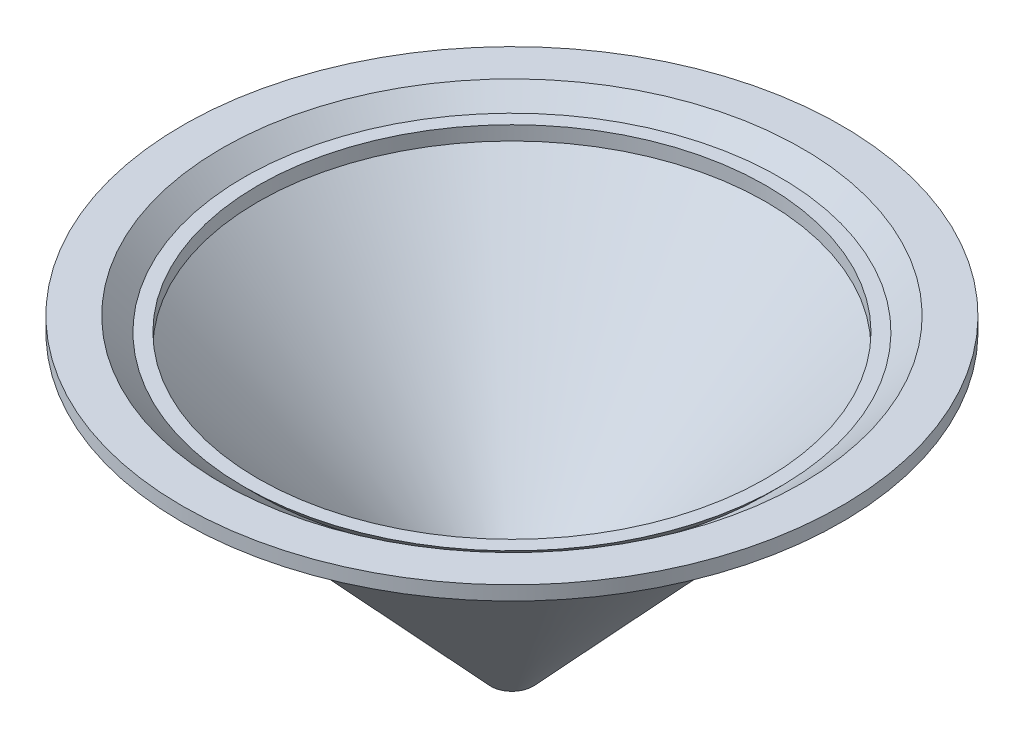
from build123d import *

# Parameters (mm, degrees)
SKETCH1_R           = 46.7275
BOSS_EXTRUDE2_DEPTH = 2


# Read off the part's stored shape, not the designer's step: Shell1
with BuildPart() as part:
    # Sketch2 → Revolve1 (revolve)
    with BuildSketch(Plane.XY):
        Polygon((0, 0), (0, -42), (-3, -42), (-42, 0), align=None)
    revolve(axis=Axis((0, 0, 0), (0, -1, 0)))

    # Sketch1 → Boss-Extrude2 (add)
    with BuildSketch(Plane(origin=(0, 0, 0), x_dir=(1, 0, 0), z_dir=(0, 1, 0))):
        with Locations(Location((0, 0, 0), (0, 0, 270))):
            Circle(SKETCH1_R)
    extrude(amount=BOSS_EXTRUDE2_DEPTH)

    # Shell1 outline → Shell1 (revolve, cut)
    with BuildSketch(Plane.XY):
        Polygon((41.127860975, 2), (0, 2), (0, -42), (0.270718118, -42), align=None)
    revolve(axis=Axis((0, 0, 0), (0, 1, 0)), mode=Mode.SUBTRACT)


with BuildPart() as body_2:
    # Sketch3 → Revolve2 (revolve)
    with BuildSketch(Plane(origin=(0, 0, 0), x_dir=(0, 0, -1), z_dir=(1, 0, 0))):
        Polygon((-38, 0), (-36, 0), (-36, -2), align=None)
    revolve(axis=Axis((0, 0, 0), (0, -1, 0)))


solid = Compound([part.part, body_2.part])
